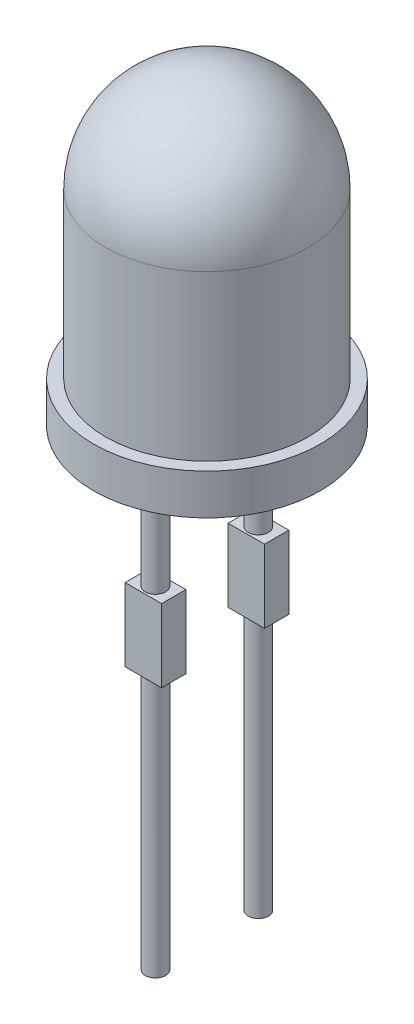
from build123d import *

# Parameters (mm, degrees)
SKETCH2_R             = 0.25
BOSS_EXTRUDE1_DEPTH   = 11
BOSS_EXTRUDE1_2_DEPTH = 11
SKETCH3_W             = 0.6
SKETCH3_H             = 1.8
BOSS_EXTRUDE2_DEPTH   = 0.45


with BuildPart() as part:
    # Sketch1 → Revolve1 (revolve)
    with BuildSketch(Plane(origin=(0, 0, 0), x_dir=(0, 0, -1), z_dir=(1, 0, 0))):
        with BuildLine():
            Line((-2.5, 2.025), (-2.5, -2.025))
            Line((-2.5, -2.025), (-2.8, -2.025))
            Line((-2.8, -2.025), (-2.8, -3.025))
            Line((-2.8, -3.025), (0, -3.025))
            Line((0, -3.025), (0, 4.525))
            ThreePointArc((0, 4.525), (-1.767766953, 3.792766953), (-2.5, 2.025))
        make_face()
    revolve(axis=Axis((0, 4.525, 0), (0, -1, 0)))


with BuildPart() as body_2:
    # Sketch2 → Boss-Extrude1 (new body)
    with BuildSketch(Plane.XZ.offset(3.025)):
        with Locations((0, 1.27)):
            Circle(SKETCH2_R)
    extrude(amount=BOSS_EXTRUDE1_DEPTH)



with BuildPart() as body_3:
    # Sketch2 → Boss-Extrude1 2 (new body)
    with BuildSketch(Plane.XZ.offset(3.025)):
        with Locations((0, -1.27)):
            Circle(SKETCH2_R)
    extrude(amount=BOSS_EXTRUDE1_2_DEPTH)


with BuildPart() as body_2_1:
    add(body_2.part)

    add(body_3.part)  # Boss-Extrude2 merges body 3
    # Sketch3 → Boss-Extrude2 (add, symmetric)
    with BuildSketch(Plane(origin=(0, 0, 0), x_dir=(0, 0, -1), z_dir=(1, 0, 0))):
        with Locations((1.27, -6.725)):
            Rectangle(SKETCH3_W, SKETCH3_H)
        with Locations((-1.27, -6.725)):
            Rectangle(SKETCH3_W, SKETCH3_H)
    extrude(amount=BOSS_EXTRUDE2_DEPTH, both=True)


solid = Compound([part.part, body_2_1.part])
